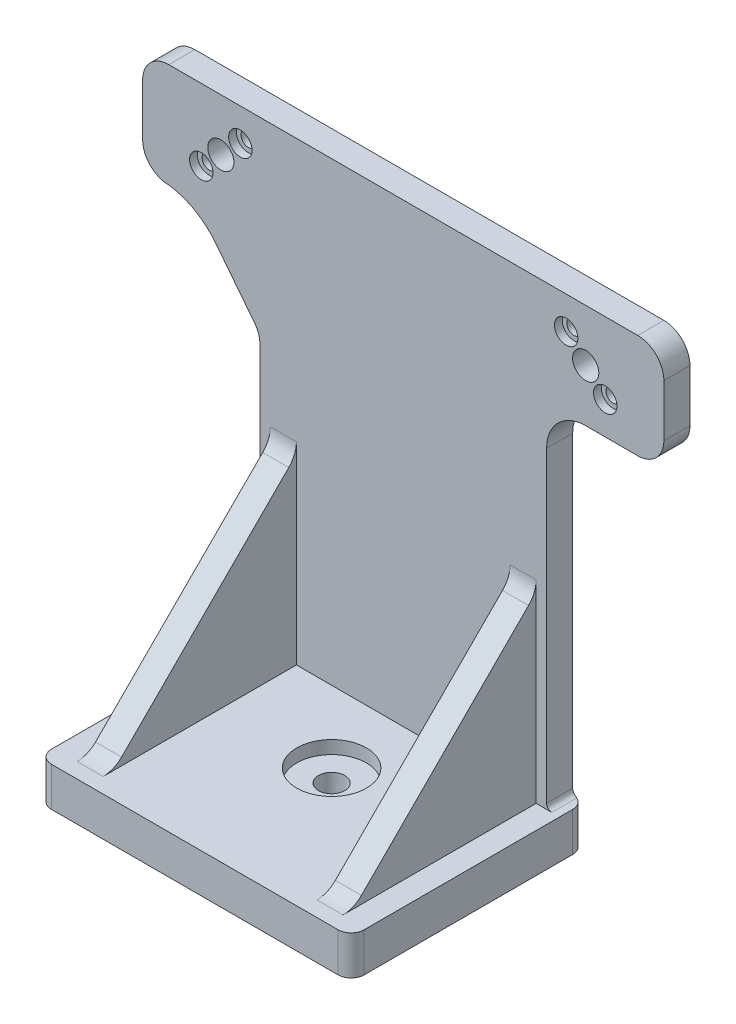
from build123d import *
from OCP.BRepAlgoAPI import BRepAlgoAPI_Cut
from OCP.TopTools import TopTools_ListOfShape

# Parameters (mm, degrees)
SKIZZE1_R                       = 5.025
SKIZZE1_R_2                     = 2.75
AUFSATZ_LINEAR_AUSTRAGEN1_DEPTH = 10
AUFSATZ_LINEAR_AUSTRAGEN3_DEPTH = 10
SKIZZE4_W                       = 120
SKIZZE4_H                       = 15
AUFSATZ_LINEAR_AUSTRAGEN4_DEPTH = 80
AUFSATZ_LINEAR_AUSTRAGEN5_DEPTH = 10
AUFSATZ_LINEAR_AUSTRAGEN6_DEPTH = 10
VERRUNDUNG3_R                   = 10
VERRUNDUNG4_R                   = 5
VERRUNDUNG5_R                   = 10
SKIZZE11_R                      = 4.5
SCHNITT_LINEAR_AUSTRAGEN1_DEPTH = 3
VERRUNDUNG6_START               = 5.0000001
VERRUNDUNG6_DEPTH               = 4.9999999
VERRUNDUNG6_START_2             = -1e-07
VERRUNDUNG6_2_DEPTH             = 5.0000002
VERRUNDUNG6_START_3             = -67.945354479
VERRUNDUNG6_3_DEPTH             = 2.945354479
SKIZZE13_R                      = 5.05
SCHNITT_LINEAR_AUSTRAGEN3_DEPTH = 221.737400671
SKIZZE14_R                      = 13.3825
SCHNITT_LINEAR_AUSTRAGEN4_DEPTH = 5


with BuildPart() as part:
    # Skizze1 → Aufsatz-Linear austragen1 (new body)
    with BuildSketch(Plane.XY):
        with BuildLine():
            Line((90, 107.054645521), (-90, 107.054645521))
            ThreePointArc((-90, 107.054645521), (-97.071067812, 104.125713333), (-100, 97.054645521))
            Line((-100, 97.054645521), (-100, 77.054645521))
            ThreePointArc((-100, 77.054645521), (-97.071067812, 69.983577709), (-90, 67.054645521))
            Line((-90, 67.054645521), (-70, 67.054645521))
            ThreePointArc((-70, 67.054645521), (-59.393398282, 62.661247239), (-55, 52.054645521))
            Line((-55, 52.054645521), (-55, -67.945354479))
            Line((-55, -67.945354479), (-60, -67.945354479))
            Line((-60, -67.945354479), (-60, -82.945354479))
            Line((-60, -82.945354479), (60, -82.945354479))
            Line((60, -82.945354479), (60, -67.945354479))
            Line((60, -67.945354479), (55, -67.945354479))
            Line((55, -67.945354479), (55, 52.054645521))
            ThreePointArc((55, 52.054645521), (59.393398282, 62.661247239), (70, 67.054645521))
            Line((70, 67.054645521), (90, 67.054645521))
            ThreePointArc((90, 67.054645521), (97.071067812, 69.983577709), (100, 77.054645521))
            Line((100, 77.054645521), (100, 97.054645521))
            ThreePointArc((100, 97.054645521), (97.071067812, 104.125713333), (90, 107.054645521))
        make_face()
        with Locations((-70, 87.054645521)):
            Circle(SKIZZE1_R, mode=Mode.SUBTRACT)
        with Locations((-62.5, 94.554645521)):
            Circle(SKIZZE1_R_2, mode=Mode.SUBTRACT)
        with Locations((-77.5, 79.554645521)):
            Circle(SKIZZE1_R_2, mode=Mode.SUBTRACT)
        with Locations(Location((77.5, 79.554645521, 0), (0, 0, 180))):
            Circle(SKIZZE1_R_2, mode=Mode.SUBTRACT)
        with Locations(Location((62.5, 94.554645521, 0), (0, 0, 180))):
            Circle(SKIZZE1_R_2, mode=Mode.SUBTRACT)
        with Locations(Location((70, 87.054645521, 0), (0, 0, 180))):
            Circle(SKIZZE1_R, mode=Mode.SUBTRACT)
    extrude(amount=AUFSATZ_LINEAR_AUSTRAGEN1_DEPTH)

    # Skizze3 → Aufsatz-Linear austragen3 (add)
    with BuildSketch(Plane.XY.offset(10)):
        with BuildLine():
            Line((-72.845922337, 57.814606503), (-56.774282723, 37.352261221))
            add(Edge.make_bspline(
                [(-55, 18.961003518), (-46.636539725, 27.963101216), (-56.774282723, 37.352261221)],
                knots=[0, 0, 0, 1, 1, 1], degree=2))
            Line((-55, 18.961003518), (-43.333440031, 21.200490786))
            Line((-43.333440031, 21.200490786), (-45.498025685, 67.054645521))
            Line((-45.498025685, 67.054645521), (-90, 67.054645521))
            add(Edge.make_bspline(
                [(-90, 67.054645521), (-79.938268155, 65.656359823), (-72.845922337, 57.814606503)],
                knots=[0, 0, 0, 1, 1, 1], degree=2))
        make_face()
    extrude(amount=-AUFSATZ_LINEAR_AUSTRAGEN3_DEPTH)

    # Skizze4 → Aufsatz-Linear austragen4 (add)
    with BuildSketch(Plane.XY.offset(10)):
        with Locations((0, -75.445354479)):
            Rectangle(SKIZZE4_W, SKIZZE4_H)
    extrude(amount=AUFSATZ_LINEAR_AUSTRAGEN4_DEPTH)

    # Skizze9 → Aufsatz-Linear austragen5 (add)
    with BuildSketch(Plane.ZY.offset(51)):
        Polygon((10, 2.054645521), (80, -67.945354479), (6.644184354, -67.945354479), (6.644184354, 2.054645521), align=None)
    extrude(amount=-AUFSATZ_LINEAR_AUSTRAGEN5_DEPTH)

    # Skizze10 → Aufsatz-Linear austragen6 (add)
    with BuildSketch(Plane(origin=(51, 0, 0), x_dir=(0, 0, -1), z_dir=(1, 0, 0))):
        Polygon((-10, 2.204645521), (-80, -67.945354479), (-10, -67.945354479), align=None)
    extrude(amount=-AUFSATZ_LINEAR_AUSTRAGEN6_DEPTH)

    # Verrundung3
    verrundung3_edges = [part.edges().sort_by_distance(p)[0] for p in [
        (-46, -67.945354479, 80),
        (-46, 2.054645521, 10),
        (46, 2.204645521, 10),
        (46, -67.945354479, 80),
    ]]
    fillet(verrundung3_edges, radius=VERRUNDUNG3_R)

    # Verrundung4
    verrundung4_edges = [part.edges().sort_by_distance(p)[0] for p in [
        (-60, -75.445354479, 90),
        (60, -75.445354479, 90),
        (60, -75.445354479, 0),
        (-60, -75.445354479, 0),
    ]]
    fillet(verrundung4_edges, radius=VERRUNDUNG4_R)

    # Verrundung5
    # the kernel refuses this fillet: 10 mm, written as the material it adds along each edge
    with BuildSketch(Plane(origin=(-55, 35.554962551, 0), x_dir=(0, -1, 0), z_dir=(0, 0, 1))) as verrundung5_piece_1:
        with BuildLine():
            CenterArc((3.889315022, -10), VERRUNDUNG5_R, 90, 34.65693161)
            Line((-1.79729867, -1.774282723), (-1.911030943, -1.609768377))
            ThreePointArc((-1.911030943, -1.609768377), (-1.060157902, -0.723908397), (-0.133322184, 0.14908117))
            Line((-0.133322184, 0.14908117), (0, 0.2))
            Line((0, 0.2), (3.889315022, 0.2))
            Line((3.889315022, 0.2), (3.889315022, 0))
        make_face()
    extrude(amount=10)

    # Skizze11 → Schnitt-Linear austragen1 (cut)
    with BuildSketch(Plane.XY.offset(10)):
        with Locations((62.5, 94.554645521)):
            Circle(SKIZZE11_R)
        with Locations((77.5, 79.554645521)):
            Circle(SKIZZE11_R)
        with Locations((-62.5, 94.554645521)):
            Circle(SKIZZE11_R)
        with Locations((-77.5, 79.554645521)):
            Circle(SKIZZE11_R)
    extrude(amount=-SCHNITT_LINEAR_AUSTRAGEN1_DEPTH, mode=Mode.SUBTRACT)


with BuildPart() as verrundung6_tool:
    # Verrundung6: read off the stored shape, not the designer's step
    # Verrundung6 outline → Verrundung6 (new body)
    with BuildSketch(Plane.XY.offset(VERRUNDUNG6_START)):
        with BuildLine():
            Line((-57, -67.945354479), (-55, -67.945354479))
            Line((-55, -67.945354479), (-55, -65.945354479))
            ThreePointArc((-55, -65.945354479), (-55.585786438, -67.359568041), (-57, -67.945354479))
        make_face()
        with BuildLine():
            ThreePointArc((57, -67.945354479), (55.585786438, -67.359568041), (55, -65.945354479))
            Line((55, -65.945354479), (55, -67.945354479))
            Line((55, -67.945354479), (57, -67.945354479))
        make_face()
    extrude(amount=VERRUNDUNG6_DEPTH)


with BuildPart() as part_1:
    add(part.part)


with BuildPart() as part_2:
    # Verrundung6: joined with verrundung6_tool
    add(part_1.part.fuse(verrundung6_tool.part, tol=0.00001))


with BuildPart() as verrundung6_2_tool:
    # Verrundung6 2 outline → Verrundung6 2 (new body)
    with BuildSketch(Plane.XY.offset(VERRUNDUNG6_START_2)):
        with BuildLine():
            Line((-57, -67.945354479), (-55, -67.945354479))
            Line((-55, -67.945354479), (-55, -65.945354479))
            ThreePointArc((-55, -65.945354479), (-55.585786438, -67.359568041), (-57, -67.945354479))
        make_face()
        with BuildLine():
            ThreePointArc((57, -67.945354479), (55.585786438, -67.359568041), (55, -65.945354479))
            Line((55, -65.945354479), (55, -67.945354479))
            Line((55, -67.945354479), (57, -67.945354479))
        make_face()
    extrude(amount=VERRUNDUNG6_2_DEPTH)


with BuildPart() as part_3:
    add(part_2.part)


with BuildPart() as part_4:
    # Verrundung6 2: joined with verrundung6_2_tool
    add(part_3.part.fuse(verrundung6_2_tool.part, tol=0.00001))


with BuildPart() as verrundung6_3_tool:
    # Verrundung6 3 outline → Verrundung6 3 (new body)
    with BuildSketch(Plane(origin=(0, 0, 0), x_dir=(1, 0, 0), z_dir=(0, 1, 0)).offset(VERRUNDUNG6_START_3)):
        with BuildLine():
            Line((59, -3.288e-06), (55, 0))
            ThreePointArc((55, 0), (57.236067978, -0.527864045), (59, -2))
            Line((59, -2), (59, -3.288e-06))
        make_face()
        with BuildLine():
            ThreePointArc((-59, -2), (-57.236067913, -0.527864013), (-54.999999856, 0))
            Line((-54.999999856, 0), (-59, -5e-09))
            Line((-59, -5e-09), (-59, -2))
        make_face()
    extrude(amount=VERRUNDUNG6_3_DEPTH)


with BuildPart() as part_5:
    add(part_4.part)

    # Verrundung6 3: cut by verrundung6_3_tool, with a tolerance
    verrundung6_3_stock = TopTools_ListOfShape()
    verrundung6_3_stock.Append(part_5.part.wrapped)
    verrundung6_3_tools = TopTools_ListOfShape()
    verrundung6_3_tools.Append(verrundung6_3_tool.part.wrapped)
    verrundung6_3_cut = BRepAlgoAPI_Cut()
    verrundung6_3_cut.SetArguments(verrundung6_3_stock)
    verrundung6_3_cut.SetTools(verrundung6_3_tools)
    verrundung6_3_cut.SetFuzzyValue(0.00001)
    verrundung6_3_cut.Build()
    add(Compound.cast(verrundung6_3_cut.Shape()).solids(), mode=Mode.REPLACE)

    # Skizze13 → Schnitt-Linear austragen3 (cut, through all)
    with BuildSketch(Plane(origin=(0, -67.945354479, 0), x_dir=(1, 0, 0), z_dir=(0, 1, 0))):
        with Locations(Location((0, -37.5, 0), (0, 0, 270))):
            Circle(SKIZZE13_R)
    extrude(amount=-SCHNITT_LINEAR_AUSTRAGEN3_DEPTH, mode=Mode.SUBTRACT)

    # Skizze14 → Schnitt-Linear austragen4 (cut)
    with BuildSketch(Plane(origin=(0, -67.945354479, 0), x_dir=(1, 0, 0), z_dir=(0, 1, 0))):
        with Locations(Location((0, -37.5, 0), (0, 0, 270))):
            Circle(SKIZZE14_R)
    extrude(amount=-SCHNITT_LINEAR_AUSTRAGEN4_DEPTH, mode=Mode.SUBTRACT)


solid = part_5.part
